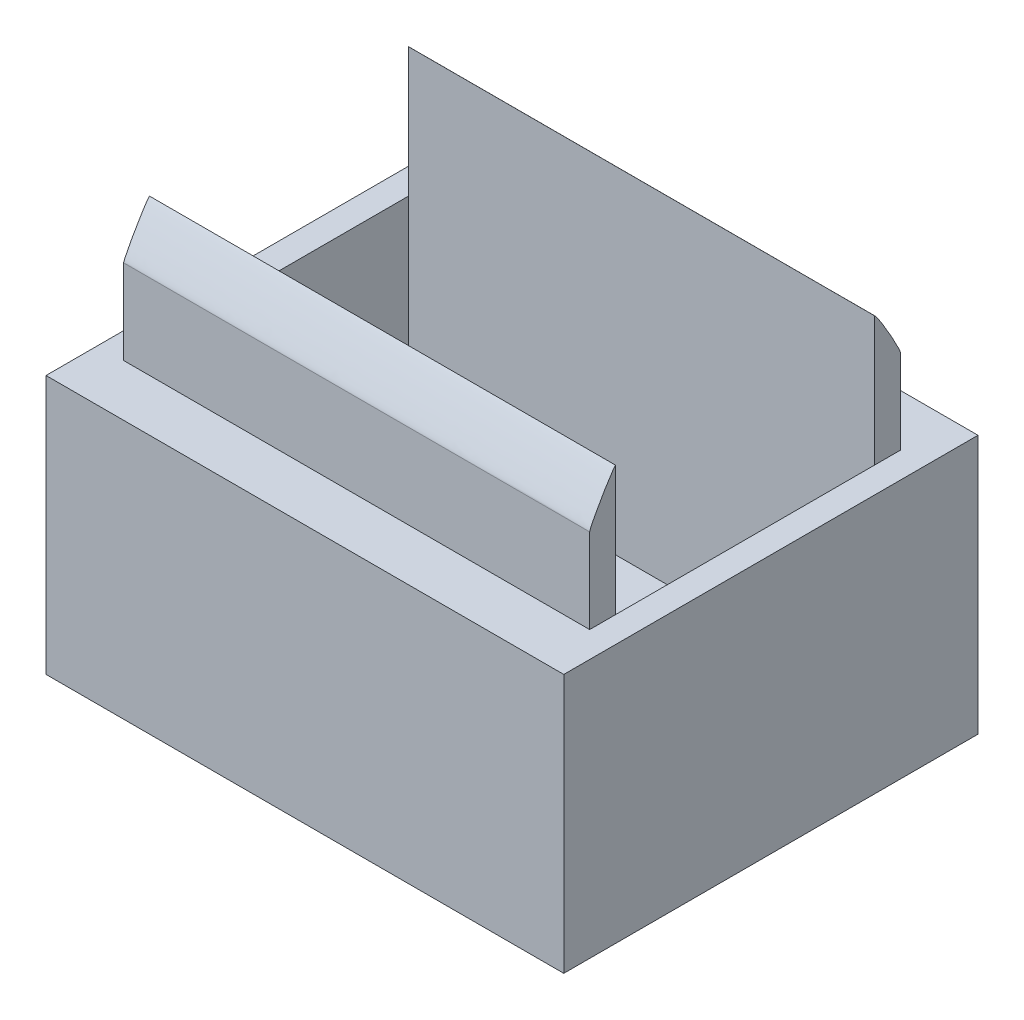
from build123d import *

# Parameters (mm, degrees)
CROQUIS1_W              = 20
CROQUIS1_H              = 16
SALIENTE_EXTRUIR1_DEPTH = 2
CROQUIS2_W              = 20
CROQUIS2_H              = 16
CROQUIS2_W_2            = 18
CROQUIS2_H_2            = 10
SALIENTE_EXTRUIR2_DEPTH = 8
CROQUIS3_W              = 18
CROQUIS3_H              = 1
SALIENTE_EXTRUIR3_DEPTH = 5
REDONDEO1_START         = -9
REDONDEO1_DEPTH         = 18


with BuildPart() as part:
    # Croquis1 → Saliente-Extruir1 (new body)
    with BuildSketch(Plane(origin=(0, 0, 0), x_dir=(1, 0, 0), z_dir=(0, 1, 0))):
        Rectangle(CROQUIS1_W, CROQUIS1_H)
    extrude(amount=SALIENTE_EXTRUIR1_DEPTH)

    # Croquis2 → Saliente-Extruir2 (add)
    with BuildSketch(Plane(origin=(0, 2, 0), x_dir=(1, 0, 0), z_dir=(0, 1, 0))):
        Rectangle(CROQUIS2_W, CROQUIS2_H)
        Rectangle(CROQUIS2_W_2, CROQUIS2_H_2, mode=Mode.SUBTRACT)
    extrude(amount=SALIENTE_EXTRUIR2_DEPTH)

    # Croquis3 → Saliente-Extruir3 (add)
    with BuildSketch(Plane(origin=(0, 10, 0), x_dir=(1, 0, 0), z_dir=(0, 1, 0))):
        with Locations((0, -5.5)):
            Rectangle(CROQUIS3_W, CROQUIS3_H)
        with Locations((0, 5.5)):
            Rectangle(CROQUIS3_W, CROQUIS3_H)
    extrude(amount=SALIENTE_EXTRUIR3_DEPTH)

    # Redondeo1: read off the stored shape, not the designer's step
    # Redondeo1 outline → Redondeo1 (cut)
    with BuildSketch(Plane.YZ.offset(REDONDEO1_START)):
        with BuildLine():
            Line((15, 6), (13.267949192, 6))
            add(Edge.make_bspline(
                [(13.267949192, 6), (14.422649731, 6), (15, 5)],
                knots=[0, 0, 0, 1, 1, 1], degree=2, weights=[1, 0.111111111, 1]))
            Line((15, 5), (15, 6))
        make_face()
        with BuildLine():
            Line((15, -6), (15, -5))
            add(Edge.make_bspline(
                [(15, -5), (14.422649731, -6), (13.267949192, -6)],
                knots=[0, 0, 0, 1, 1, 1], degree=2, weights=[1, 0.111111111, 1]))
            Line((13.267949192, -6), (15, -6))
        make_face()
    extrude(amount=REDONDEO1_DEPTH, mode=Mode.SUBTRACT)


solid = part.part
